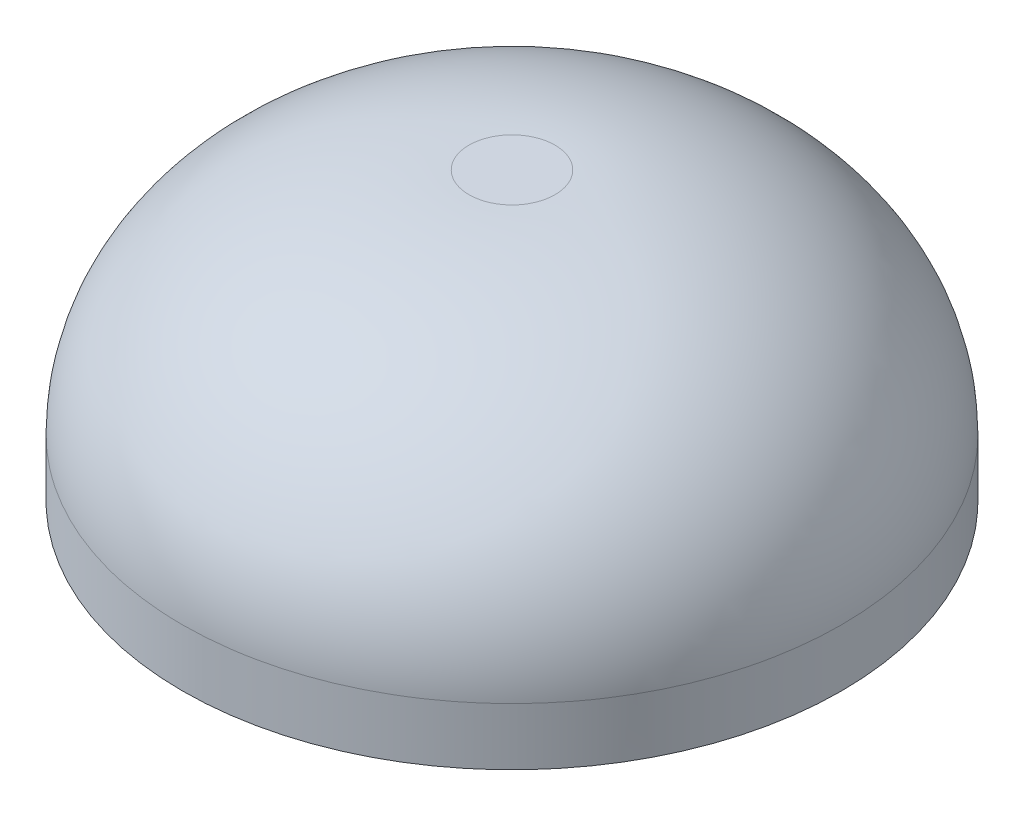
from build123d import *

# Parameters (mm, degrees)
SKETCH1_R           = 11.5
BOSS_EXTRUDE1_DEPTH = 10
FILLET1_SIZE        = 8
FILLET1_SIZE_2      = 10
SKETCH2_R           = 7
CUT_EXTRUDE1_DEPTH  = 7
SKETCH3_R           = 4.558249482
CUT_EXTRUDE2_DEPTH  = 2.5


with BuildPart() as part:
    # Sketch1 → Boss-Extrude1 (new body)
    with BuildSketch(Plane(origin=(0, 0, 0), x_dir=(1, 0, 0), z_dir=(0, 1, 0))):
        with Locations(Location((0, 0, 0), (0, 0, 270))):
            Circle(SKETCH1_R)
    extrude(amount=BOSS_EXTRUDE1_DEPTH)

    # Fillet1
    # an asymmetric fillet: 10, 8 mm, written as the material it takes off along each edge
    with BuildSketch(Plane(origin=(0, 10, 0), x_dir=(0, 0, 1), z_dir=(-1, 0, 0))) as fillet1_piece_1:
        with BuildLine():
            Bezier((11.5, -FILLET1_SIZE), (11.5, 0), (11.5 - FILLET1_SIZE_2, 0), weights=[1, 0.707106781, 1])
            Line((11.5 - FILLET1_SIZE_2, 0), (11.5, 0))
            Line((11.5, 0), (11.5, -FILLET1_SIZE))
        make_face()
    revolve(axis=Axis((0, 10, 0), (0, 1, 0)), mode=Mode.SUBTRACT)

    # Sketch2 → Cut-Extrude1 (cut)
    with BuildSketch(Plane.XZ):
        with Locations(Location((0, 0, 0), (0, 0, 270))):
            Circle(SKETCH2_R)
        Polygon((2.95, -1.703183294), (2.95, 1.703183294), (0, 3.406366588), (-2.95, 1.703183294), (-2.95, -1.703183294), (0, -3.406366588), align=None, mode=Mode.SUBTRACT)
    extrude(amount=-CUT_EXTRUDE1_DEPTH, mode=Mode.SUBTRACT)

    # Sketch3 → Cut-Extrude2 (cut)
    with BuildSketch(Plane.XZ):
        Circle(SKETCH3_R)
    extrude(amount=-CUT_EXTRUDE2_DEPTH, mode=Mode.SUBTRACT)


solid = part.part
